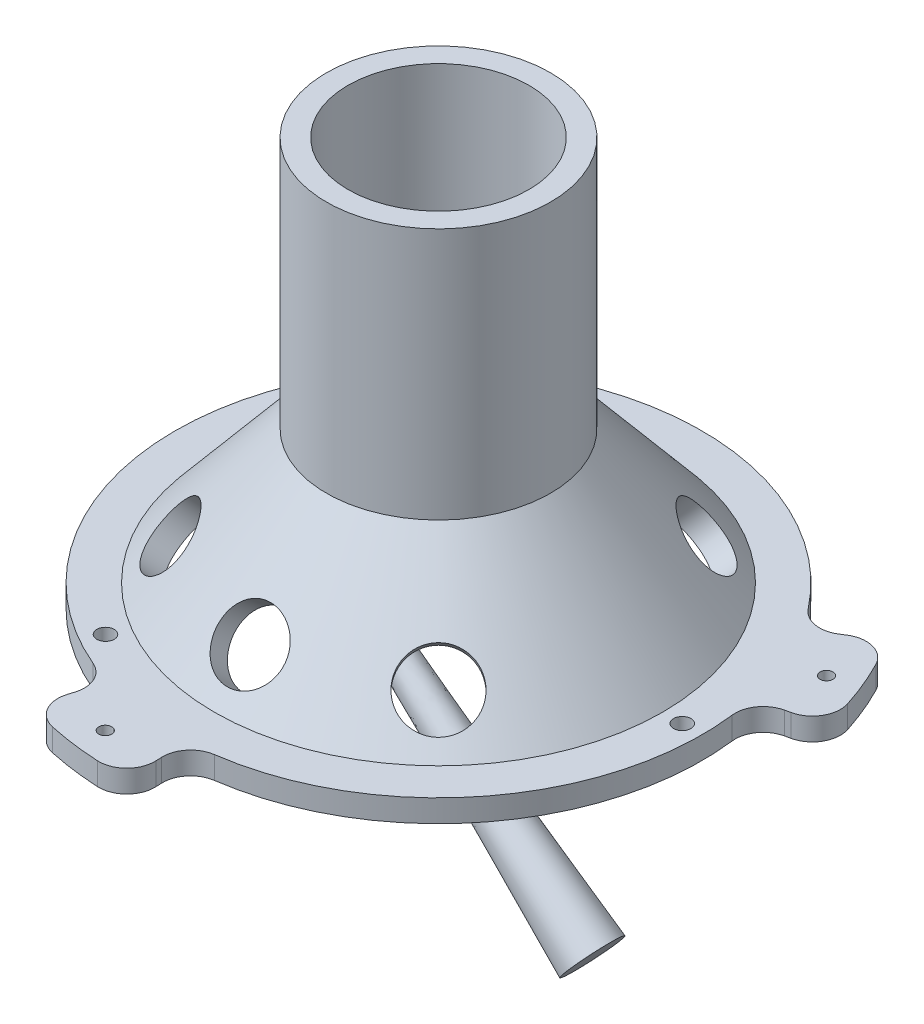
from build123d import *

# Parameters (mm, degrees)
R_P_TITION_CIRCULAIRE1_COUNT               = 4
R_P_TITION_CIRCULAIRE1_ANGLE               = 135
R_P_TITION_CIRCULAIRE1_THE_OTHER_WAY_COUNT = 4
R_P_TITION_CIRCULAIRE1_THE_OTHER_WAY_ANGLE = 135
ESQUISSE4_R                                = 20
BOSS_EXTRU_1_DEPTH                         = 45
ENL_V_MAT_EXTRU_1_REACH                    = 100.605
ESQUISSE5_R                                = 5.9
ENL_V_MAT_EXTRU_2_REACH                    = 84.577
ESQUISSE6_R                                = 16.134769367
BOSS_EXTRU_4_START                         = -4
ESQUISSE13_R                               = 58
ESQUISSE13_R_2                             = 1.15
ESQUISSE13_R_3                             = 47
BOSS_EXTRU_4_DEPTH                         = 4
ENL_V_START                                = -4
ENL_V_MAT_EXTRU_4_DEPTH                    = 4
CONG_1_R                                   = 5
ESQUISSE15_R                               = 1.55
ENL_V_MAT_EXTRU_5_DEPTH                    = 4


with BuildPart() as part:
    # Esquisse1 → Révolution2 (revolve)
    with BuildSketch(Plane.XY, mode=Mode.PRIVATE) as r_volution2_sk:
        Polygon((-47, -19.835071852), (-47, -23.835071852), (-38.134769367, -23.835071852), (-18.134769367, 0), (0, 0), (0, 4), (-20, 4), (-40, -19.835071852), align=None)
    revolve(r_volution2_sk.sketch.rotate(Axis((0, 0, 0), (0, 1, 0)), 270), axis=Axis((0, 0, 0), (0, 1, 0)))

    # Esquisse3 → Enlèvement de matière-Révolution1 (revolve, cut)
    with BuildSketch(Plane.XY, mode=Mode.PRIVATE) as enl_vement_de_mati_re_r_volution1_sk:
        Polygon((-34.592271058, -11.834667631), (-30.7355454, -7.238400972), (-10.956403255, -23.835071852), (-14.813128913, -28.431338511), align=None)
    enl_vement_de_mati_re_r_volution1 = revolve(enl_vement_de_mati_re_r_volution1_sk.sketch.rotate(Axis((-34.592271058, -11.834667631, 0), (0.7660444431189795, -0.6427876096865376, 0)), 205.991108416), axis=Axis((-34.592271058, -11.834667631, 0), (0.7660444431189795, -0.6427876096865376, 0)), mode=Mode.SUBTRACT)

    # Répétition circulaire1: Enlèvement de matière-Révolution1 ×4 about axis
    r_p_tition_circulaire1_axis = Axis((0, 4, 0), (0, -1, 0))
    for i in range(1, R_P_TITION_CIRCULAIRE1_COUNT):
        add(enl_vement_de_mati_re_r_volution1.rotate(r_p_tition_circulaire1_axis, i * R_P_TITION_CIRCULAIRE1_ANGLE / (R_P_TITION_CIRCULAIRE1_COUNT - 1)), mode=Mode.SUBTRACT)

    # Répétition circulaire1 the other way: Enlèvement de matière-Révolution1 ×4 about axis
    r_p_tition_circulaire1_the_other_way_axis = Axis((0, 4, 0), (0, 1, 0))
    for i in range(1, R_P_TITION_CIRCULAIRE1_THE_OTHER_WAY_COUNT):
        add(enl_vement_de_mati_re_r_volution1.rotate(r_p_tition_circulaire1_the_other_way_axis, i * R_P_TITION_CIRCULAIRE1_THE_OTHER_WAY_ANGLE / (R_P_TITION_CIRCULAIRE1_THE_OTHER_WAY_COUNT - 1)), mode=Mode.SUBTRACT)

    # Esquisse4 → Boss.-Extru.1 (add)
    with BuildSketch(Plane(origin=(0, 4, 0), x_dir=(1, 0, 0), z_dir=(0, 1, 0))):
        with Locations(Location((0, 0, 0), (0, 0, 90))):
            Circle(ESQUISSE4_R)
    extrude(amount=BOSS_EXTRU_1_DEPTH)

    # Esquisse5 → Enlèv. mat.-Extru.1 (cut, up to next)
    with BuildSketch(Plane(origin=(0, 49, 0), x_dir=(1, 0, 0), z_dir=(0, 1, 0)), mode=Mode.PRIVATE) as enl_v_mat_extru_1_sk1:
        with Locations(Location((0, 0, 0), (0, 0, 270))):
            Circle(ESQUISSE5_R)
    enl_v_mat_extru_1_tool1 = extrude(enl_v_mat_extru_1_sk1.sketch, amount=-ENL_V_MAT_EXTRU_1_REACH, mode=Mode.PRIVATE) & part.part
    add(enl_v_mat_extru_1_tool1.solids().sort_by_distance((0, 49, 0))[0], mode=Mode.SUBTRACT)

    # Esquisse6 → Enlèv. mat.-Extru.2 (cut, up to next)
    with BuildSketch(Plane(origin=(0, 0, 0), x_dir=(-1, 0, 0), z_dir=(0, -1, 0)), mode=Mode.PRIVATE) as enl_v_mat_extru_2_sk1:
        with Locations(Location((0, 0, 0), (0, 0, 90))):
            Circle(ESQUISSE6_R)
    enl_v_mat_extru_2_tool1 = extrude(enl_v_mat_extru_2_sk1.sketch, amount=-ENL_V_MAT_EXTRU_2_REACH, mode=Mode.PRIVATE) & part.part
    add(enl_v_mat_extru_2_tool1.solids().sort_by_distance((0, 0, 0))[0], mode=Mode.SUBTRACT)

    # Esquisse13 → Boss.-Extru.4 (add)
    with BuildSketch(Plane(origin=(0, -19.835071852, 0), x_dir=(1, 0, 0), z_dir=(0, 1, 0)).offset(BOSS_EXTRU_4_START)):
        with Locations(Location((0, 0, 0), (0, 0, 270))):
            Circle(ESQUISSE13_R)
        with Locations(Location((48.965615223, 20.282221915, 0), (0, 0, 270))):
            Circle(ESQUISSE13_R_2, mode=Mode.SUBTRACT)
        with Locations(Location((-42.047727035, 32.264355737, 0), (0, 0, 270))):
            Circle(ESQUISSE13_R_2, mode=Mode.SUBTRACT)
        with Locations(Location((-6.917888188, -52.546577653, 0), (0, 0, 270))):
            Circle(ESQUISSE13_R_2, mode=Mode.SUBTRACT)
        Circle(ESQUISSE13_R_3, mode=Mode.SUBTRACT)
    extrude(amount=BOSS_EXTRU_4_DEPTH)

    # Esquisse14 → Enlèv. mat.-Extru.4 (cut)
    with BuildSketch(Plane(origin=(0, -19.835071852, 0), x_dir=(1, 0, 0), z_dir=(0, 1, 0)).offset(ENL_V_START)):
        with BuildLine():
            Line((-39.184232042, 42.762085535), (-31.752739758, 34.65203483))
            ThreePointArc((-31.752739758, 34.65203483), (6.134731034, 46.597908485), (39.639397953, 25.253081592))
            Line((39.639397953, 25.253081592), (48.916703857, 31.163377284))
            ThreePointArc((48.916703857, 31.163377284), (7.570519149, 57.50380196), (-39.184232042, 42.762085535))
        make_face()
        with BuildLine():
            Line((56.625168413, 12.553497608), (45.885912335, 10.172661855))
            ThreePointArc((45.885912335, 10.172661855), (46.720647896, 5.116743118), (47, 0))
            ThreePointArc((47, 0), (33.951106217, -32.501113622), (2.050111206, -46.955266414))
            Line((2.050111206, -46.955266414), (2.529924467, -57.944796852))
            ThreePointArc((2.529924467, -57.944796852), (41.897109799, -40.107757235), (58, 0))
            ThreePointArc((58, 0), (57.655267617, 6.314278741), (56.625168413, 12.553497608))
        make_face()
        with BuildLine():
            ThreePointArc((-14.133172577, -44.824696685), (-43.422338028, -17.986121321), (-41.689509159, 21.702184822))
            Line((-41.689509159, 21.702184822), (-51.446628324, 26.781419568))
            ThreePointArc((-51.446628324, 26.781419568), (-53.585012886, -22.195639077), (-17.440936371, -55.315583143))
            Line((-17.440936371, -55.315583143), (-14.133172577, -44.824696685))
        make_face()
    extrude(amount=ENL_V_MAT_EXTRU_4_DEPTH, mode=Mode.SUBTRACT)

    # Congé1
    cong_1_edges = [part.edges().sort_by_distance(p)[0] for p in [
        (39.639397953, -21.835071852, -25.253081592),
        (-31.752739758, -21.835071852, -34.65203483),
        (-39.184232042, -21.835071852, -42.762085535),
        (48.916703857, -21.835071852, -31.163377284),
        (-41.689509159, -21.835071852, -21.702184822),
        (-14.133172577, -21.835071852, 44.824696685),
        (-17.440936371, -21.835071852, 55.315583143),
        (-51.446628324, -21.835071852, -26.781419568),
        (2.050111206, -21.835071852, 46.955266414),
        (45.885912335, -21.835071852, -10.172661855),
        (56.625168413, -21.835071852, -12.553497608),
        (2.529924467, -21.835071852, 57.944796852),
    ]]
    fillet(cong_1_edges, radius=CONG_1_R)

    # Esquisse15 → Enlèv. mat.-Extru.5 (cut)
    with BuildSketch(Plane(origin=(0, -19.835071852, 0), x_dir=(1, 0, 0), z_dir=(0, 1, 0))):
        with Locations(Location((43.5, 0, 0), (0, 0, 270))):
            Circle(ESQUISSE15_R)
        with Locations(Location((-21.75, -37.672105065, 0), (0, 0, 270))):
            Circle(ESQUISSE15_R)
        with Locations(Location((-21.75, 37.672105065, 0), (0, 0, 270))):
            Circle(ESQUISSE15_R)
    extrude(amount=-ENL_V_MAT_EXTRU_5_DEPTH, mode=Mode.SUBTRACT)


with BuildPart() as body_2:
    # Lissage1: read off the stored shape, not the designer's step
    # Lissage1: loft between two sections, ruled curve by curve
    lissage1_from = [
        Edge.make_bspline([(27.180627497, -64.230223828, -4.881054685), (20.90566455, -71.708433464, -4.020112959), (21.459067224, -71.048913839, 5.741996411), (27.734030171, -63.570704203, 4.881054685), (34.008993118, -56.092494567, 4.020112959), (33.455590444, -56.752014193, -5.741996411), (27.180627497, -64.230223828, -4.881054685)], [0, 0, 0, 0, 0.5, 0.5, 0.5, 1, 1, 1, 1], 3, [1, 0.333333333, 0.333333333, 1, 0.333333333, 0.333333333, 1]),
    ]
    lissage1_to = [
        Edge.make_bspline([(-32.24584042, -10.594024315, -0.453020203), (-32.828231968, -11.288091534, -5.370309122), (-35.989004358, -15.054953385, -4.464268715), (-35.40661281, -14.360886166, 0.453020203), (-34.824221263, -13.666818948, 5.370309122), (-31.663448873, -9.899957097, 4.464268715), (-32.24584042, -10.594024315, -0.453020203)], [0, 0, 0, 0, 0.5, 0.5, 0.5, 1, 1, 1, 1], 3, [1, 0.333333333, 0.333333333, 1, 0.333333333, 0.333333333, 1]),
    ]
    lissage1 = Solid(Shell([*[Face.make_surface_from_curves(lissage1_from[k], lissage1_to[k]) for k in range(1)], Face(Wire(lissage1_from)), Face(Wire(lissage1_to))]))
    add(lissage1)


solid = Compound([part.part, body_2.part])
